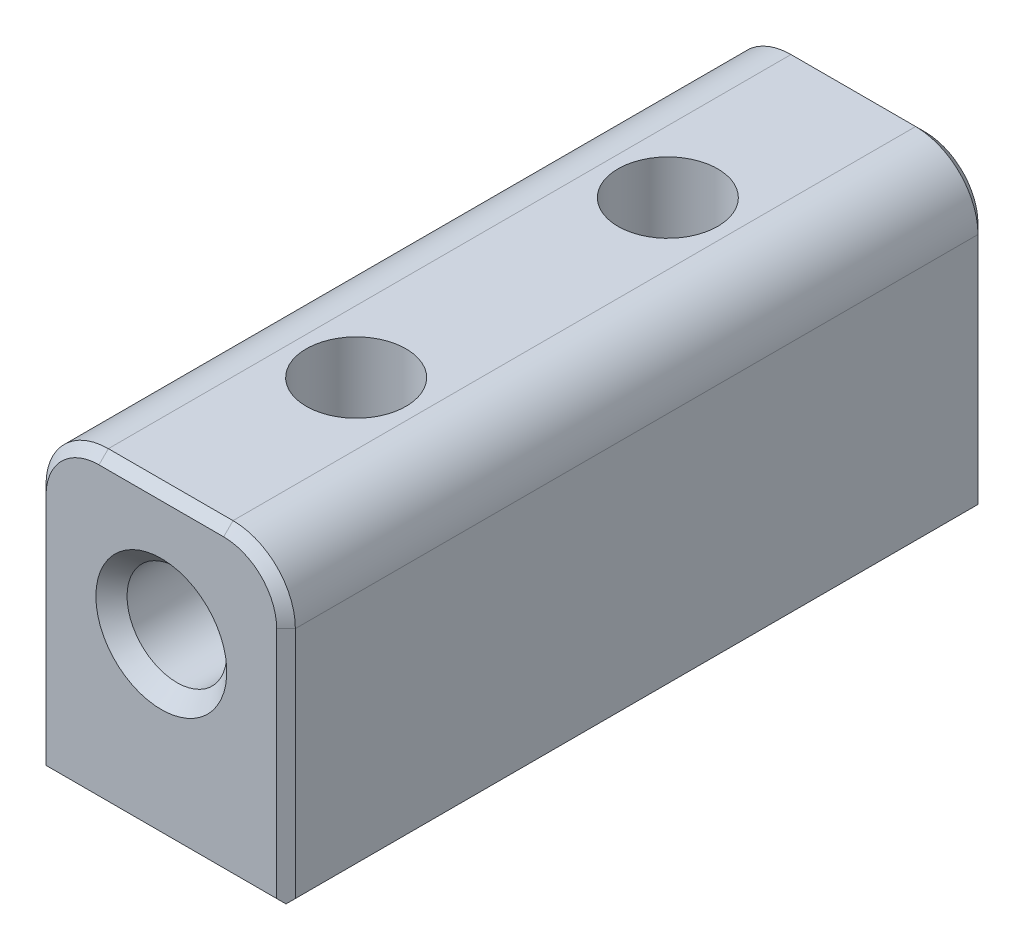
from build123d import *

# Parameters (mm, degrees)
SKETCH1_W           = 10.16
SKETCH1_H           = 28.575
SKETCH1_R           = 2.032
BOSS_EXTRUDE1_DEPTH = 12.7
SKETCH2_R           = 2.032
CUT_EXTRUDE1_DEPTH  = 3.3274
CUT_EXTRUDE2_START  = -3.3274
SKETCH4_R           = 2.032
CUT_EXTRUDE2_DEPTH  = 3.3274
FILLET1_R           = 2.54
CHAMFER1_SIZE       = 0.635
CHAMFER2_SIZE       = 0.381


with BuildPart() as part:
    # Sketch1 → Boss-Extrude1 (new body)
    with BuildSketch(Plane(origin=(0, 0, 0), x_dir=(1, 0, 0), z_dir=(0, 1, 0))):
        Rectangle(SKETCH1_W, SKETCH1_H)
        with Locations((0, 6.35)):
            Circle(SKETCH1_R, mode=Mode.SUBTRACT)
        with Locations((0, -6.35)):
            Circle(SKETCH1_R, mode=Mode.SUBTRACT)
    extrude(amount=BOSS_EXTRUDE1_DEPTH)

    # Sketch2 → Cut-Extrude1 (cut)
    with BuildSketch(Plane.XY.offset(14.2875)):
        with Locations((0, 7.62)):
            Circle(SKETCH2_R)
    extrude(amount=-CUT_EXTRUDE1_DEPTH, mode=Mode.SUBTRACT)

    # Sketch4 → Cut-Extrude2 (cut)
    with BuildSketch(Plane(origin=(0, 0, -14.2875), x_dir=(-1, 0, 0), z_dir=(0, 0, -1)).offset(CUT_EXTRUDE2_START)):
        with Locations((0, 7.62)):
            Circle(SKETCH4_R)
    extrude(amount=CUT_EXTRUDE2_DEPTH, mode=Mode.SUBTRACT)

    # Fillet1
    fillet1_edges = [part.edges().sort_by_distance(p)[0] for p in [
        (5.08, 12.7, 0),
        (-5.08, 12.7, 0),
    ]]
    fillet(fillet1_edges, radius=FILLET1_R)

    # Chamfer1
    chamfer1_edges = [part.edges().sort_by_distance(p)[0] for p in [
        (-2.032, 0, 6.35),
        (-2.032, 0, -6.35),
        (0, 0, 14.2875),
        (5.08, 0, 0),
        (0, 0, -14.2875),
        (-5.08, 0, 0),
        (2.032, 7.62, -14.2875),
        (-2.032, 7.62, 14.2875),
    ]]
    chamfer(chamfer1_edges, length=CHAMFER1_SIZE)

    # Chamfer2
    chamfer2_edges = [part.edges().sort_by_distance(p)[0] for p in [
        (-5.08, 5.3975, -14.2875),
        (-4.336051224, 11.956051224, -14.2875),
        (0, 12.7, -14.2875),
        (4.336051224, 11.956051224, -14.2875),
        (5.08, 5.3975, -14.2875),
        (-5.08, 5.3975, 14.2875),
        (-4.336051224, 11.956051224, 14.2875),
        (0, 12.7, 14.2875),
        (4.336051224, 11.956051224, 14.2875),
        (5.08, 5.3975, 14.2875),
    ]]
    chamfer(chamfer2_edges, length=CHAMFER2_SIZE)


solid = part.part
